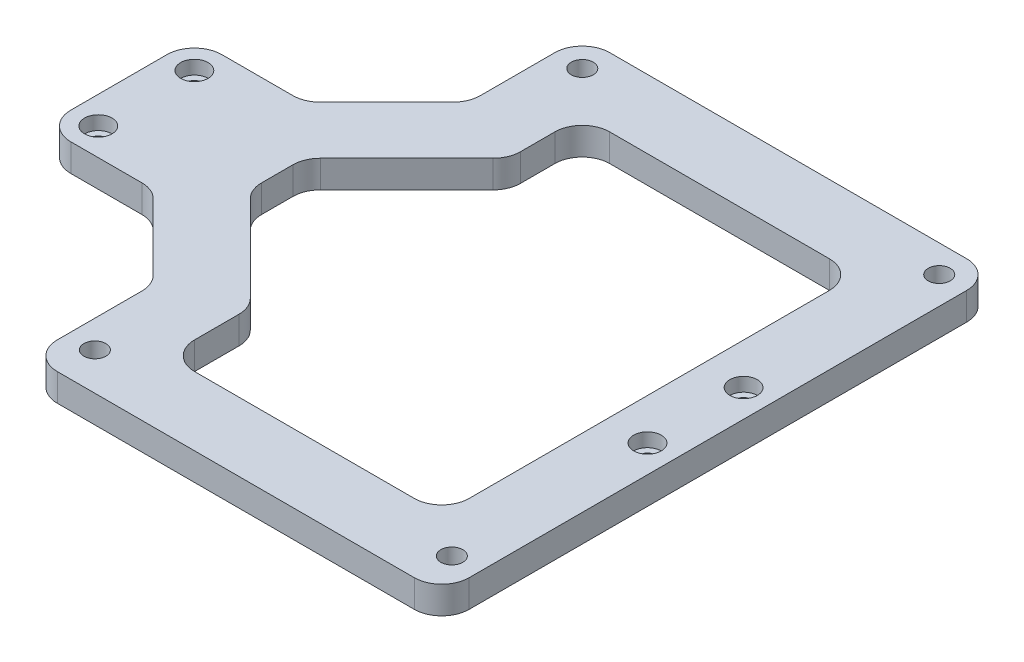
from build123d import *

# Parameters (mm, degrees)
SKETCH_2_R          = 1.6
SKETCH_2_R_2        = 1.05
EXTRUDE_1_DEPTH     = 4
SKETCH_3_R          = 2
CUT_EXTRUDE_1_DEPTH = 2
CHAMFER_1_SIZE      = 12
CUT_EXTRUDE_2_REACH = 70.1
FILLET_1_R          = 4
FILLET_2_R          = 4


with BuildPart() as part:
    # 草图2 → 凸台-拉伸1 (new body)
    with BuildSketch(Plane(origin=(0, 0, 0), x_dir=(1, 0, 0), z_dir=(0, 1, 0))):
        Polygon((54.25, -40.970824348), (54.25, 39.5), (-5.75, 39.5), (-5.75, 11), (-33.75, 11), (-33.75, -11), (-5.75, -11), (-5.75, -40.970824348), align=None)
        with Locations((-1.75, -35.5)):
            Circle(SKETCH_2_R, mode=Mode.SUBTRACT)
        with Locations((50.25, -35.5)):
            Circle(SKETCH_2_R, mode=Mode.SUBTRACT)
        with Locations((50.25, 7)):
            Circle(SKETCH_2_R_2, mode=Mode.SUBTRACT)
        with Locations((-29.75, -7)):
            Circle(SKETCH_2_R_2, mode=Mode.SUBTRACT)
        with Locations((50.25, -7)):
            Circle(SKETCH_2_R_2, mode=Mode.SUBTRACT)
        with Locations((-29.75, 7)):
            Circle(SKETCH_2_R_2, mode=Mode.SUBTRACT)
        with Locations((50.25, 35.5)):
            Circle(SKETCH_2_R, mode=Mode.SUBTRACT)
        with Locations((-1.75, 35.5)):
            Circle(SKETCH_2_R, mode=Mode.SUBTRACT)
    extrude(amount=EXTRUDE_1_DEPTH)

    # 草图3 → 切除-拉伸1 (cut)
    with BuildSketch(Plane(origin=(0, 4, 0), x_dir=(1, 0, 0), z_dir=(0, 1, 0))):
        with Locations((-29.75, 7)):
            Circle(SKETCH_3_R)
        with Locations((-29.75, -7)):
            Circle(SKETCH_3_R)
        with Locations((50.25, 7)):
            Circle(SKETCH_3_R)
        with Locations((50.25, -7)):
            Circle(SKETCH_3_R)
    extrude(amount=-CUT_EXTRUDE_1_DEPTH, mode=Mode.SUBTRACT)

    # 倒角1
    chamfer_1_edges = [part.edges().sort_by_distance(p)[0] for p in [
        (-5.75, 2, 11),
        (-5.75, 2, -11),
    ]]
    chamfer(chamfer_1_edges, length=CHAMFER_1_SIZE)

    # 草图5 → 切除-拉伸2 (cut, up to next)
    with BuildSketch(Plane.XZ, mode=Mode.PRIVATE) as cut_extrude_2_sk1:
        Polygon((-10.678932188, 3.928932188), (-10.678932188, -3.928932188), (4.25, -18.857864376), (4.25, -29.5), (44.25, -29.5), (44.25, 30.970824348), (4.25, 30.970824348), (4.25, 18.857864376), align=None)
    cut_extrude_2_tool1 = extrude(cut_extrude_2_sk1.sketch, amount=-CUT_EXTRUDE_2_REACH, mode=Mode.PRIVATE) & part.part
    add(cut_extrude_2_tool1.solids().sort_by_distance((21.064665, 0, 0.644737))[0], mode=Mode.SUBTRACT)

    # 圆角1
    fillet_1_edges = [part.edges().sort_by_distance(p)[0] for p in [
        (-33.75, 2, -11),
        (54.25, 2, -39.5),
        (54.25, 2, 40.970824348),
        (-5.75, 2, 40.970824348),
        (-33.75, 2, 11),
        (-5.75, 2, -39.5),
        (-5.75, 2, 23),
        (-5.75, 2, -23),
        (-17.75, 2, -11),
        (-17.75, 2, 11),
    ]]
    fillet(fillet_1_edges, radius=FILLET_1_R)

    # 圆角2
    fillet_2_edges = [part.edges().sort_by_distance(p)[0] for p in [
        (44.25, 2, 30.970824348),
        (44.25, 2, -29.5),
        (4.25, 2, -18.857864376),
        (-10.678932188, 2, -3.928932188),
        (-10.678932188, 2, 3.928932188),
        (4.25, 2, 18.857864376),
        (4.25, 2, 30.970824348),
        (4.25, 2, -29.5),
    ]]
    fillet(fillet_2_edges, radius=FILLET_2_R)


solid = part.part
